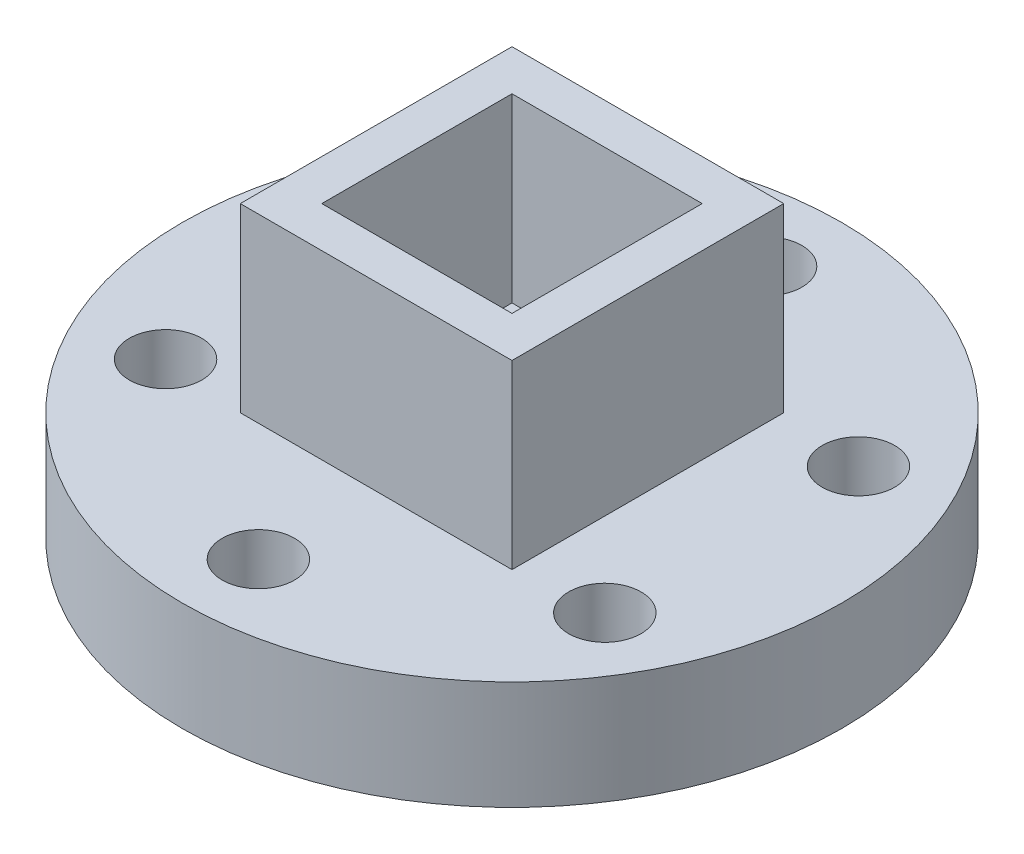
from build123d import *

# Parameters (mm, degrees)
SKETCH1_R           = 18.2
BOSS_EXTRUDE1_DEPTH = 6
SKETCH2_R           = 2
CUT_EXTRUDE1_DEPTH  = 6
SKETCH3_W           = 15
SKETCH3_H           = 15
BOSS_EXTRUDE2_DEPTH = 10
SKETCH5_W           = 10.5
SKETCH5_H           = 10.5
CUT_EXTRUDE2_DEPTH  = 10


with BuildPart() as part:
    # Sketch1 → Boss-Extrude1 (new body)
    with BuildSketch(Plane(origin=(0, 0, 0), x_dir=(1, 0, 0), z_dir=(0, 1, 0))):
        Circle(SKETCH1_R)
    extrude(amount=BOSS_EXTRUDE1_DEPTH)

    # Sketch2 → Cut-Extrude1 (cut)
    with BuildSketch(Plane(origin=(0, 6, 0), x_dir=(1, 0, 0), z_dir=(0, 1, 0))):
        with Locations((0, 14)):
            Circle(SKETCH2_R)
        with Locations((12.124355653, 7)):
            Circle(SKETCH2_R)
        with Locations((12.124355653, -7)):
            Circle(SKETCH2_R)
        with Locations((0, -14)):
            Circle(SKETCH2_R)
        with Locations((-12.124355653, -7)):
            Circle(SKETCH2_R)
        with Locations((-12.124355653, 7)):
            Circle(SKETCH2_R)
    extrude(amount=-CUT_EXTRUDE1_DEPTH, mode=Mode.SUBTRACT)

    # Sketch3 → Boss-Extrude2 (add)
    with BuildSketch(Plane(origin=(0, 6, 0), x_dir=(1, 0, 0), z_dir=(0, 1, 0))):
        Rectangle(SKETCH3_W, SKETCH3_H)
    extrude(amount=BOSS_EXTRUDE2_DEPTH)

    # Sketch5 → Cut-Extrude2 (cut)
    with BuildSketch(Plane(origin=(0, 16, 0), x_dir=(1, 0, 0), z_dir=(0, 1, 0))):
        Rectangle(SKETCH5_W, SKETCH5_H)
    extrude(amount=-CUT_EXTRUDE2_DEPTH, mode=Mode.SUBTRACT)


solid = part.part
